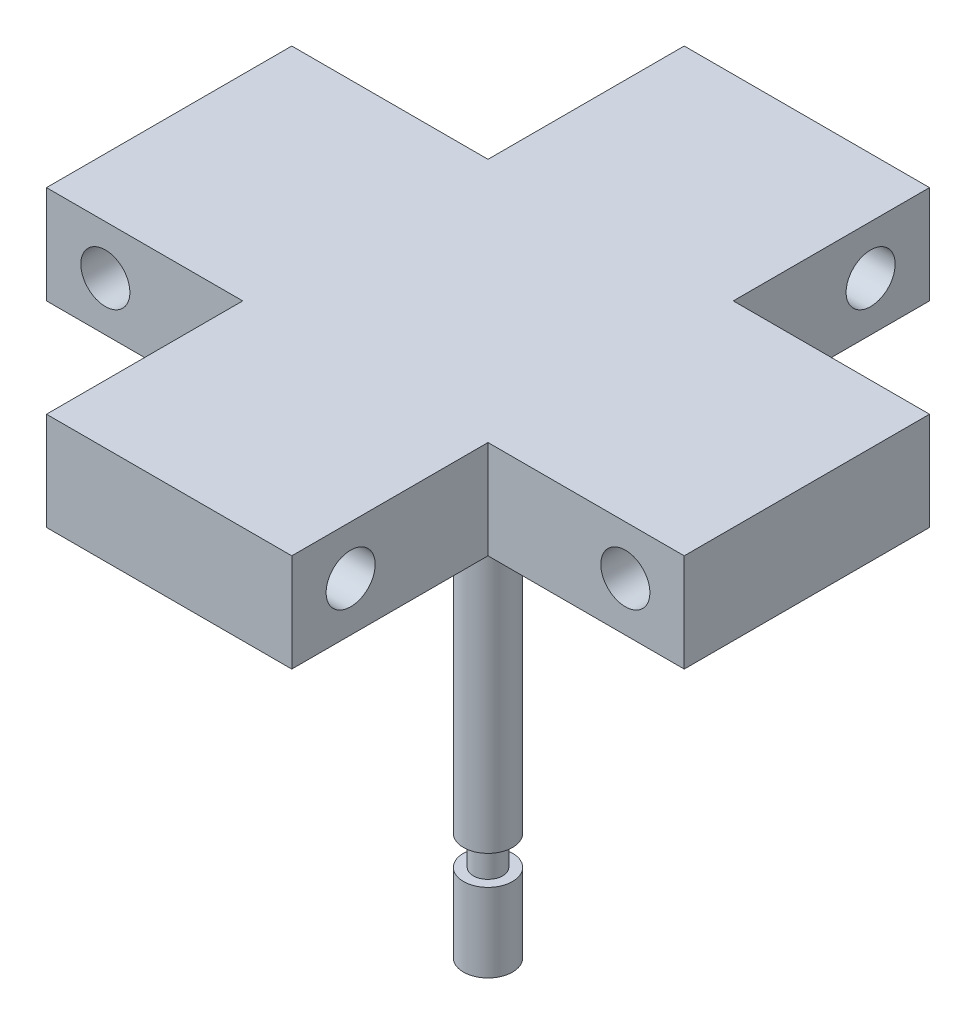
from build123d import *

# Parameters (mm, degrees)
BOSS_EXTRUDE1_DEPTH = 10
SKETCH2_R           = 2.5
CUT_EXTRUDE1_DEPTH  = 57.402570863
SKETCH3_R           = 2.5
CUT_EXTRUDE2_DEPTH  = 57.402570863
SKETCH4_R           = 2.5
BOSS_EXTRUDE2_DEPTH = 48
SKETCH5_W           = 1
SKETCH5_H           = 3


with BuildPart() as part:
    # Sketch1 → Boss-Extrude1 (new body)
    with BuildSketch(Plane(origin=(0, 0, 0), x_dir=(1, 0, 0), z_dir=(0, 1, 0))):
        Polygon((12.5, -32.5), (12.5, -12.5), (32.5, -12.5), (32.5, 12.5), (12.5, 12.5), (12.5, 32.5), (-12.5, 32.5), (-12.5, 12.5), (-32.5, 12.5), (-32.5, -12.5), (-12.5, -12.5), (-12.5, -32.5), align=None)
    extrude(amount=BOSS_EXTRUDE1_DEPTH)

    # Sketch2 → Cut-Extrude1 (cut, through all)
    with BuildSketch(Plane(origin=(12.5, 0, 0), x_dir=(0, 0, -1), z_dir=(1, 0, 0))):
        with Locations((-26.499999999, 5)):
            Circle(SKETCH2_R)
        with Locations((26.499999999, 5)):
            Circle(SKETCH2_R)
    extrude(amount=-CUT_EXTRUDE1_DEPTH, mode=Mode.SUBTRACT)

    # Sketch3 → Cut-Extrude2 (cut, through all)
    with BuildSketch(Plane.XY.offset(12.5)):
        with Locations((26.5, 5)):
            Circle(SKETCH3_R)
        with Locations((-26.5, 5)):
            Circle(SKETCH3_R)
    extrude(amount=-CUT_EXTRUDE2_DEPTH, mode=Mode.SUBTRACT)

    # Sketch4 → Boss-Extrude2 (add)
    with BuildSketch(Plane(origin=(0, 0, 0), x_dir=(1, 0, 0), z_dir=(0, 1, 0))):
        Circle(SKETCH4_R)
    extrude(amount=-BOSS_EXTRUDE2_DEPTH)

    # Sketch5 → Cut-Revolve1 (revolve, cut)
    with BuildSketch(Plane(origin=(0, 0, 0), x_dir=(0, 0, -1), z_dir=(1, 0, 0))):
        with Locations((2, -38.5)):
            Rectangle(SKETCH5_W, SKETCH5_H)
    revolve(axis=Axis((0, 0, 0), (0, -1, 0)), mode=Mode.SUBTRACT)


solid = part.part
